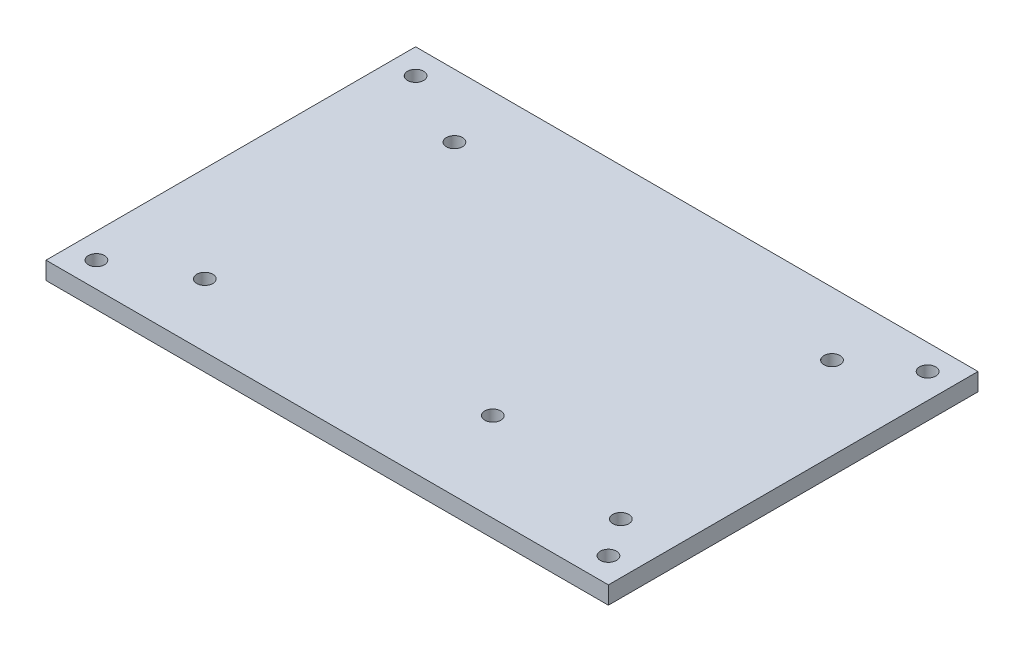
from build123d import *

# Parameters (mm, degrees)
SKETCH1_W           = 111.6
SKETCH1_H           = 73.34
SKETCH1_R           = 1.6
BOSS_EXTRUDE1_DEPTH = 3.5


with BuildPart() as part:
    # Sketch1 → Boss-Extrude1 (new body)
    with BuildSketch(Plane(origin=(0, 0, 0), x_dir=(1, 0, 0), z_dir=(0, 1, 0))):
        with Locations((55.8, 36.67)):
            Rectangle(SKETCH1_W, SKETCH1_H)
        with Locations((20.24, 60.8)):
            Circle(SKETCH1_R, mode=Mode.SUBTRACT)
        with Locations((18.97, 12.54)):
            Circle(SKETCH1_R, mode=Mode.SUBTRACT)
        with Locations((71.04, 17.62)):
            Circle(SKETCH1_R, mode=Mode.SUBTRACT)
        with Locations((101.52, 12.54)):
            Circle(SKETCH1_R, mode=Mode.SUBTRACT)
        with Locations((95.17, 60.8)):
            Circle(SKETCH1_R, mode=Mode.SUBTRACT)
        with Locations((106.6, 5)):
            Circle(SKETCH1_R, mode=Mode.SUBTRACT)
        with Locations((106.6, 68.34)):
            Circle(SKETCH1_R, mode=Mode.SUBTRACT)
        with Locations((5, 5)):
            Circle(SKETCH1_R, mode=Mode.SUBTRACT)
        with Locations((5, 68.34)):
            Circle(SKETCH1_R, mode=Mode.SUBTRACT)
    extrude(amount=BOSS_EXTRUDE1_DEPTH)


solid = part.part
